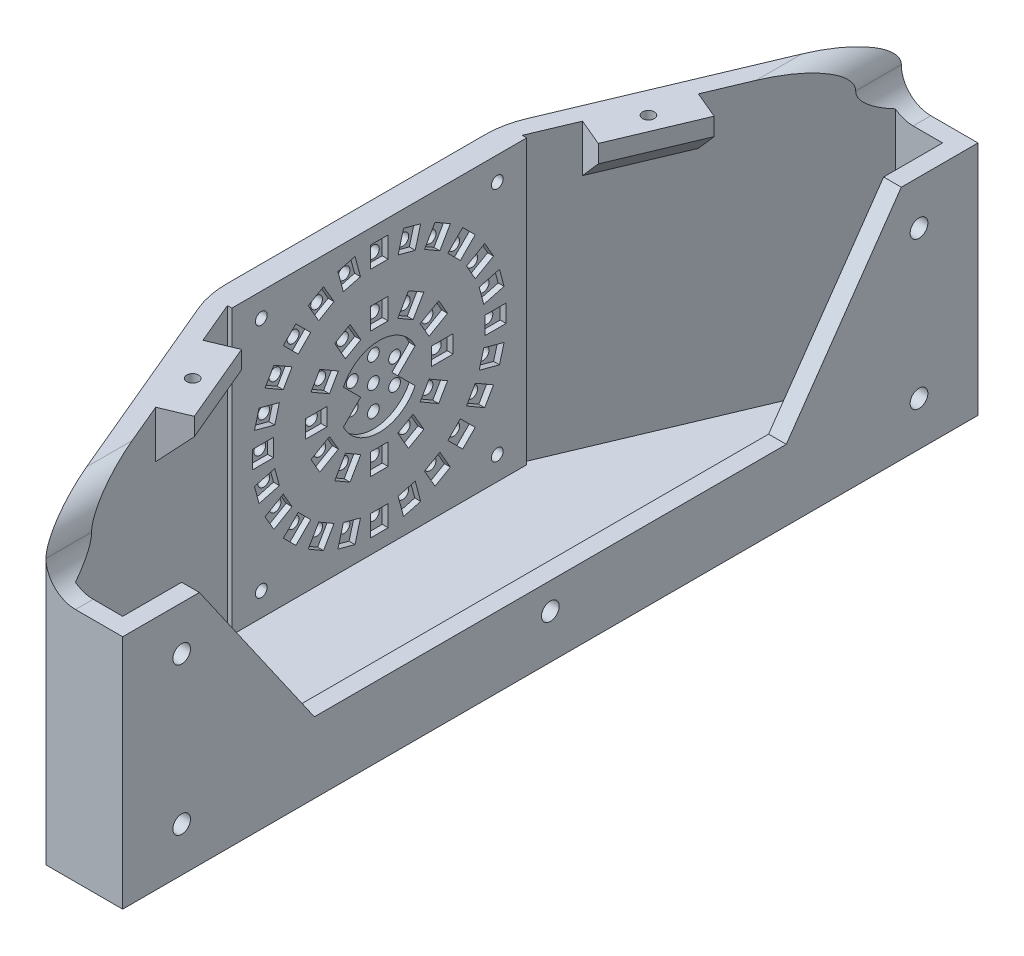
from build123d import *

# Parameters (mm, degrees)
EXTRUDE_1_DEPTH      = 4
SKETCH_2_W           = 6
SKETCH_2_H           = 290
EXTRUDE_2_DEPTH      = 80
EXTRUDE_1_2_DEPTH    = 96
SKETCH_29_W          = 8
SKETCH_29_H          = 100
EXTRUDE_5_DEPTH      = 96
SKETCH_20_W          = 6
SKETCH_20_H          = 7.125217771
SKETCH_20_W_2        = 7.125217771
SKETCH_20_H_2        = 6
SKETCH_20_H_3        = 7.251760651
SKETCH_20_W_3        = 7.251760651
CUT_EXTRUDE_7_DEPTH  = 2
SKETCH_16_R          = 3
CUT_EXTRUDE_6_DEPTH  = 20
SKETCH_21_R          = 2
LED_DEPTH            = 10
SKETCH_22_W          = 26
SKETCH_22_H          = 290
CUT_EXTRUDE_9_DEPTH  = 20
FILLET_2_R           = 10
FILLET_3_R           = 30
SKETCH_23_W          = 30
SKETCH_23_H          = 6
EXTRUDE_3_DEPTH      = 10
SKETCH_24_W          = 30
SKETCH_24_H          = 6
EXTRUDE_4_DEPTH      = 10
CHAMFER_1_SIZE       = 10
CUT_EXTRUDE_10_DEPTH = 10
CHAMFER_2_SIZE       = 2
SKETCH_30_R          = 2
CUT_EXTRUDE_11_DEPTH = 7
SKETCH_32_R          = 2
CUT_EXTRUDE_13_DEPTH = 7
CHAMFER_3_SIZE       = 2
CHAMFER_4_SIZE       = 2


# Some blends are built 0.0001 mm under size
with BuildPart() as part:
    # Эскиз1 → Extrude 1 (new body)
    with BuildSketch(Plane(origin=(0, 0, 0), x_dir=(1, 0, 0), z_dir=(0, 1, 0))):
        Polygon((-50, -50), (-50, 50), (-10, 145), (10, 145), (10, -145), (-10, -145), align=None)
    extrude(amount=EXTRUDE_1_DEPTH)

    # Эскиз2 → Бобышка-Вытянуть2 (add)
    with BuildSketch(Plane(origin=(0, 0, 0), x_dir=(1, 0, 0), z_dir=(0, 1, 0))):
        with Locations((13, 0)):
            Rectangle(SKETCH_2_W, SKETCH_2_H)
    extrude(amount=EXTRUDE_2_DEPTH)

    # Эскиз17 → Extrude 1 2 (add)
    with BuildSketch(Plane(origin=(0, 4, 0), x_dir=(1, 0, 0), z_dir=(0, 1, 0))):
        Polygon((-10, 145), (-50, 50), (-50, -50), (-10, -145), (16, -145), (16, 145), align=None)
        Polygon((-6.016149012, 139), (-44, 48.788353904), (-44, -48.788353904), (-6.016149012, -139), (10, -139), (10, 139), align=None, mode=Mode.SUBTRACT)
    extrude(amount=EXTRUDE_1_2_DEPTH)

    # Эскиз29 → Бобышка-Вытянуть5 (add)
    with BuildSketch(Plane(origin=(0, 100, 0), x_dir=(1, 0, 0), z_dir=(0, 1, 0))):
        with Locations((-46, 0)):
            Rectangle(SKETCH_29_W, SKETCH_29_H)
    extrude(amount=-EXTRUDE_5_DEPTH)

    # Эскиз20 → Вырез-Вытянуть7 (cut)
    with BuildSketch(Plane(origin=(-42, 0, 0), x_dir=(0, 0, -1), z_dir=(1, 0, 0))):
        Polygon((8.231441461, 94.311267666), (6.387299401, 87.428835803), (12.182854359, 85.875921532), (14.026996418, 92.758353395), align=None)
        with BuildLine():
            Line((6.3, 52), (12.161242978, 57.861242978))
            ThreePointArc((12.161242978, 57.861242978), (0, 65.5), (-12.161242978, 57.861242978))
            Line((-12.161242978, 57.861242978), (-6.3, 52))
            Line((-6.3, 52), (-12.161242978, 46.138757022))
            ThreePointArc((-12.161242978, 46.138757022), (0, 38.5), (12.161242978, 46.138757022))
            Line((12.161242978, 46.138757022), (6.3, 52))
        make_face()
        with Locations((0, 91.437391115)):
            Rectangle(SKETCH_20_W, SKETCH_20_H)
        Polygon((18.901923789, 90.739092363), (15.339314903, 84.568472766), (20.535467326, 81.568472766), (24.098076211, 87.739092363), align=None)
        Polygon((28.284271247, 84.526911935), (23.245981444, 79.488622131), (27.488622131, 75.245981444), (32.526911935, 80.284271247), align=None)
        Polygon((35.739092363, 76.098076211), (29.568472766, 72.535467326), (32.568472766, 67.339314903), (38.739092363, 70.901923789), align=None)
        Polygon((40.758353395, 66.026996418), (33.875921532, 64.182854359), (35.428835803, 58.387299401), (42.311267666, 60.231441461), align=None)
        with Locations((39.437391115, 52)):
            Rectangle(SKETCH_20_W_2, SKETCH_20_H_2)
        Polygon((42.311267666, 43.768558539), (35.428835803, 45.612700599), (33.875921532, 39.817145641), (40.758353395, 37.973003582), align=None)
        Polygon((38.739092363, 33.098076211), (32.568472766, 36.660685097), (29.568472766, 31.464532674), (35.739092363, 27.901923789), align=None)
        Polygon((32.526911935, 23.715728753), (27.488622131, 28.754018556), (23.245981444, 24.511377869), (28.284271247, 19.473088065), align=None)
        Polygon((24.098076211, 16.260907637), (20.535467326, 22.431527234), (15.339314903, 19.431527234), (18.901923789, 13.260907637), align=None)
        Polygon((14.026996418, 11.241646605), (12.182854359, 18.124078468), (6.387299401, 16.571164197), (8.231441461, 9.688732334), align=None)
        with Locations((0, 12.562608886)):
            Rectangle(SKETCH_20_W, SKETCH_20_H)
        Polygon((-8.231441461, 9.688732334), (-6.387299401, 16.571164197), (-12.182854359, 18.124078468), (-14.026996418, 11.241646605), align=None)
        Polygon((-18.901923789, 13.260907637), (-15.339314903, 19.431527234), (-20.535467326, 22.431527234), (-24.098076211, 16.260907637), align=None)
        Polygon((-28.284271247, 19.473088065), (-23.245981444, 24.511377869), (-27.488622131, 28.754018556), (-32.526911935, 23.715728753), align=None)
        Polygon((-35.739092363, 27.901923789), (-29.568472766, 31.464532674), (-32.568472766, 36.660685097), (-38.739092363, 33.098076211), align=None)
        Polygon((-40.758353395, 37.973003582), (-33.875921532, 39.817145641), (-35.428835803, 45.612700599), (-42.311267666, 43.768558539), align=None)
        with Locations((-39.437391115, 52)):
            Rectangle(SKETCH_20_W_2, SKETCH_20_H_2)
        Polygon((-42.311267666, 60.231441461), (-35.428835803, 58.387299401), (-33.875921532, 64.182854359), (-40.758353395, 66.026996418), align=None)
        Polygon((-38.739092363, 70.901923789), (-32.568472766, 67.339314903), (-29.568472766, 72.535467326), (-35.739092363, 76.098076211), align=None)
        Polygon((-32.526911935, 80.284271247), (-27.488622131, 75.245981444), (-23.245981444, 79.488622131), (-28.284271247, 84.526911935), align=None)
        Polygon((-24.098076211, 87.739092363), (-20.535467326, 81.568472766), (-15.339314903, 84.568472766), (-18.901923789, 90.739092363), align=None)
        Polygon((-14.026996418, 92.758353395), (-12.182854359, 85.875921532), (-6.387299401, 87.428835803), (-8.231441461, 94.311267666), align=None)
        Polygon((6.276043463, 68.870426149), (9.901923789, 75.150635095), (15.098076211, 72.150635095), (11.472195886, 65.870426149), align=None)
        with Locations((0, 73.374119675)):
            Rectangle(SKETCH_20_W, SKETCH_20_H_3)
        Polygon((13.870426149, 63.472195886), (20.150635095, 67.098076211), (23.150635095, 61.901923789), (16.870426149, 58.276043463), align=None)
        with Locations((21.374119675, 52)):
            Rectangle(SKETCH_20_W_3, SKETCH_20_H_2)
        Polygon((16.870426149, 45.723956537), (23.150635095, 42.098076211), (20.150635095, 36.901923789), (13.870426149, 40.527804114), align=None)
        Polygon((11.472195886, 38.129573851), (15.098076211, 31.849364905), (9.901923789, 28.849364905), (6.276043463, 35.129573851), align=None)
        with Locations((0, 30.625880326)):
            Rectangle(SKETCH_20_W, SKETCH_20_H_3)
        Polygon((-6.276043463, 35.129573851), (-9.901923789, 28.849364905), (-15.098076211, 31.849364905), (-11.472195886, 38.129573851), align=None)
        Polygon((-13.870426149, 40.527804114), (-20.150635095, 36.901923789), (-23.150635095, 42.098076211), (-16.870426149, 45.723956537), align=None)
        with Locations((-21.374119675, 52)):
            Rectangle(SKETCH_20_W_3, SKETCH_20_H_2)
        Polygon((-16.870426149, 58.276043463), (-23.150635095, 61.901923789), (-20.150635095, 67.098076211), (-13.870426149, 63.472195886), align=None)
        Polygon((-11.472195886, 65.870426149), (-15.098076211, 72.150635095), (-9.901923789, 75.150635095), (-6.276043463, 68.870426149), align=None)
    extrude(amount=-CUT_EXTRUDE_7_DEPTH, mode=Mode.SUBTRACT)

    # Эскиз16 → Вырез-Вытянуть6 (cut)
    with BuildSketch(Plane(origin=(16, 0, 0), x_dir=(0, 0, -1), z_dir=(1, 0, 0))):
        with Locations((0, 65)):
            Circle(SKETCH_16_R)
        with Locations((0, 15)):
            Circle(SKETCH_16_R)
        with Locations((125, 65)):
            Circle(SKETCH_16_R)
        with Locations((-125, 65)):
            Circle(SKETCH_16_R)
        with Locations((-125, 15)):
            Circle(SKETCH_16_R)
        with Locations((125, 15)):
            Circle(SKETCH_16_R)
    extrude(amount=-CUT_EXTRUDE_6_DEPTH, mode=Mode.SUBTRACT)

    # Эскиз21 → Отверстия под LED (cut)
    with BuildSketch(Plane(origin=(-42, 0, 0), x_dir=(0, 0, -1), z_dir=(1, 0, 0))):
        with Locations((0, 90.5)):
            Circle(SKETCH_21_R)
        with Locations((9.964533236, 89.188144312)):
            Circle(SKETCH_21_R)
        with Locations((19.25, 85.341978046)):
            Circle(SKETCH_21_R)
        with Locations((27.223611076, 79.223611076)):
            Circle(SKETCH_21_R)
        with Locations((33.341978046, 71.25)):
            Circle(SKETCH_21_R)
        with Locations((37.188144312, 61.964533236)):
            Circle(SKETCH_21_R)
        with Locations((38.5, 52)):
            Circle(SKETCH_21_R)
        with Locations((37.188144312, 42.035466764)):
            Circle(SKETCH_21_R)
        with Locations((33.341978046, 32.75)):
            Circle(SKETCH_21_R)
        with Locations((27.223611076, 24.776388924)):
            Circle(SKETCH_21_R)
        with Locations((19.25, 18.658021954)):
            Circle(SKETCH_21_R)
        with Locations((9.964533236, 14.811855688)):
            Circle(SKETCH_21_R)
        with Locations((0, 13.5)):
            Circle(SKETCH_21_R)
        with Locations((-9.964533236, 14.811855688)):
            Circle(SKETCH_21_R)
        with Locations((-19.25, 18.658021954)):
            Circle(SKETCH_21_R)
        with Locations((-27.223611076, 24.776388924)):
            Circle(SKETCH_21_R)
        with Locations((-33.341978046, 32.75)):
            Circle(SKETCH_21_R)
        with Locations((-37.188144312, 42.035466764)):
            Circle(SKETCH_21_R)
        with Locations((-38.5, 52)):
            Circle(SKETCH_21_R)
        with Locations((-37.188144312, 61.964533236)):
            Circle(SKETCH_21_R)
        with Locations((-33.341978046, 71.25)):
            Circle(SKETCH_21_R)
        with Locations((-27.223611076, 79.223611076)):
            Circle(SKETCH_21_R)
        with Locations((-19.25, 85.341978046)):
            Circle(SKETCH_21_R)
        with Locations((-9.964533236, 89.188144312)):
            Circle(SKETCH_21_R)
        with Locations((0, 73)):
            Circle(SKETCH_21_R)
        with Locations((10.5, 70.186533479)):
            Circle(SKETCH_21_R)
        with Locations((18.186533479, 62.5)):
            Circle(SKETCH_21_R)
        with Locations((21, 52)):
            Circle(SKETCH_21_R)
        with Locations((18.186533479, 41.5)):
            Circle(SKETCH_21_R)
        with Locations((10.5, 33.813466521)):
            Circle(SKETCH_21_R)
        with Locations((0, 31)):
            Circle(SKETCH_21_R)
        with Locations((-10.5, 33.813466521)):
            Circle(SKETCH_21_R)
        with Locations((-18.186533479, 41.5)):
            Circle(SKETCH_21_R)
        with Locations((-21, 52)):
            Circle(SKETCH_21_R)
        with Locations((-18.186533479, 62.5)):
            Circle(SKETCH_21_R)
        with Locations((-10.5, 70.186533479)):
            Circle(SKETCH_21_R)
        with Locations((0, 60.3)):
            Circle(SKETCH_21_R)
        with Locations((7.188010851, 56.15)):
            Circle(SKETCH_21_R)
        with Locations((7.188010851, 47.85)):
            Circle(SKETCH_21_R)
        with Locations((0, 43.7)):
            Circle(SKETCH_21_R)
        with Locations((-7.188010851, 47.85)):
            Circle(SKETCH_21_R)
        with Locations((-7.188010851, 56.15)):
            Circle(SKETCH_21_R)
        with Locations((0, 52)):
            Circle(SKETCH_21_R)
    extrude(amount=-LED_DEPTH, mode=Mode.SUBTRACT)

    # Эскиз22 → Вырез-Вытянуть9 (cut)
    with BuildSketch(Plane(origin=(0, 100, 0), x_dir=(1, 0, 0), z_dir=(0, 1, 0))):
        with Locations((3, 0)):
            Rectangle(SKETCH_22_W, SKETCH_22_H)
    extrude(amount=-CUT_EXTRUDE_9_DEPTH, mode=Mode.SUBTRACT)

    # Скругление2
    # the kernel refuses this fillet: 10 mm, written as the material it adds along each edge
    with BuildSketch(Plane(origin=(-10, 80, -145), x_dir=(0, 1, 0), z_dir=(0, 0, 1))) as fillet_2_piece_1_section:
        with BuildLine():
            CenterArc((FILLET_2_R, -FILLET_2_R), FILLET_2_R, 90, 90)
            Line((0, -FILLET_2_R), (0, 0))
            Line((0, 0), (FILLET_2_R, 0))
        make_face()
    fillet_2_piece_1 = extrude(amount=40.461646096, mode=Mode.PRIVATE)
    fillet_2_piece_1 = split(fillet_2_piece_1, bisect_by=Plane(origin=(-8.171006358, 82.420075, -139), z_dir=(0, 0, -1)), keep=Keep.TOP, mode=Mode.PRIVATE)
    add(fillet_2_piece_1)
    with BuildSketch(Plane(origin=(-10, 80, -170), x_dir=(0, 1, 0), z_dir=(0, 0, 1))) as fillet_2_piece_2_section:
        with BuildLine():
            CenterArc((FILLET_2_R, -FILLET_2_R), FILLET_2_R, 90, 90)
            Line((0, -FILLET_2_R), (0, 0))
            Line((0, 0), (FILLET_2_R, 0))
        make_face()
    fillet_2_piece_2 = extrude(amount=65.461646096, mode=Mode.PRIVATE)
    fillet_2_piece_2 = split(fillet_2_piece_2, bisect_by=Plane(origin=(-7.715017751, 83.017793979, -134.965186746), z_dir=(-0.9216353751380651, 0, -0.38805700005813326)), keep=Keep.TOP, mode=Mode.PRIVATE)
    fillet_2_piece_2 = split(fillet_2_piece_2, bisect_by=Plane(origin=(-8.969192832, 83.017793979, -139), z_dir=(0, 0, 1)), keep=Keep.TOP, mode=Mode.PRIVATE)
    add(fillet_2_piece_2)
    with BuildSketch(Plane(origin=(-10, 80, 104.538353904), x_dir=(0, 1, 0), z_dir=(0, 0, 1))) as fillet_2_piece_3_section:
        with BuildLine():
            CenterArc((FILLET_2_R, -FILLET_2_R), FILLET_2_R, 90, 90)
            Line((0, -FILLET_2_R), (0, 0))
            Line((0, 0), (FILLET_2_R, 0))
        make_face()
    fillet_2_piece_3 = extrude(amount=40.461646096, mode=Mode.PRIVATE)
    fillet_2_piece_3 = split(fillet_2_piece_3, bisect_by=Plane(origin=(-3.828623245, 80.420001638, 139), z_dir=(0, 0, 1)), keep=Keep.TOP, mode=Mode.PRIVATE)
    add(fillet_2_piece_3)
    with BuildSketch(Plane(origin=(-10, 80, 104.538353904), x_dir=(0, 1, 0), z_dir=(0, 0, 1))) as fillet_2_piece_4_section:
        with BuildLine():
            CenterArc((FILLET_2_R, -FILLET_2_R), FILLET_2_R, 90, 90)
            Line((0, -FILLET_2_R), (0, 0))
            Line((0, 0), (FILLET_2_R, 0))
        make_face()
    fillet_2_piece_4 = extrude(amount=65.461646096, mode=Mode.PRIVATE)
    fillet_2_piece_4 = split(fillet_2_piece_4, bisect_by=Plane(origin=(-7.715017751, 83.017793979, 134.965186746), z_dir=(-0.9216353751380651, 0, 0.38805700005813315)), keep=Keep.TOP, mode=Mode.PRIVATE)
    fillet_2_piece_4 = split(fillet_2_piece_4, bisect_by=Plane(origin=(-8.969192832, 83.017793979, 139), z_dir=(0, 0, -1)), keep=Keep.TOP, mode=Mode.PRIVATE)
    add(fillet_2_piece_4)
    # the kernel refuses this fillet: 10 mm, written as the material it takes off along each edge
    with BuildSketch(Plane(origin=(-10, 100, -170), x_dir=(0, -1, 0), z_dir=(0, 0, 1)), Plane(origin=(-10, 100, 104.538353904), x_dir=(0, -1, 0), z_dir=(0, 0, 1))) as fillet_2_2_piece_1:
        with BuildLine():
            CenterArc((FILLET_2_R, -FILLET_2_R), FILLET_2_R, 90, 90)
            Line((0, -FILLET_2_R), (0, 0))
            Line((0, 0), (FILLET_2_R, 0))
        make_face()
    extrude(amount=65.461646096, mode=Mode.SUBTRACT)

    # Скругление3
    fillet_3_edges = [part.edges().sort_by_distance(p)[0] for p in [
        (-50, 50, 50),
        (-50, 50, -50),
    ]]
    fillet(fillet_3_edges, radius=FILLET_3_R)

    # Эскиз23 → Бобышка-Вытянуть3 (add)
    with BuildSketch(Plane(origin=(-54.823128926, 0, -23.083422706), x_dir=(0.38805700005813276, 0, -0.9216353751380653), z_dir=(0.9216353751380653, 0, 0.38805700005813276))):
        with Locations((59.783374754, 97)):
            Rectangle(SKETCH_23_W, SKETCH_23_H)
    extrude(amount=EXTRUDE_3_DEPTH)

    # Эскиз24 → Бобышка-Вытянуть4 (add)
    with BuildSketch(Plane(origin=(-54.823128926, 0, 23.083422706), x_dir=(-0.3880570000581327, 0, -0.9216353751380654), z_dir=(0.9216353751380654, 0, -0.3880570000581327))):
        with Locations((-59.783374754, 97)):
            Rectangle(SKETCH_24_W, SKETCH_24_H)
    extrude(amount=EXTRUDE_4_DEPTH)

    # Фаска1
    chamfer_1_edges = [part.edges().sort_by_distance(p)[0] for p in [
        (-31.623771865, 94, -78.181895724),
        (-31.623771865, 94, 78.181895724),
    ]]
    chamfer(chamfer_1_edges, length=CHAMFER_1_SIZE - 0.0001)  # a hair under: the kernel refuses the full size

    # Эскиз27 → Вырез-Вытянуть10 (cut)
    with BuildSketch(Plane(origin=(16, 0, 0), x_dir=(0, 0, -1), z_dir=(1, 0, 0))):
        Polygon((-80, 24), (80, 24), (119, 80), (-119, 80), align=None)
    extrude(amount=-CUT_EXTRUDE_10_DEPTH, mode=Mode.SUBTRACT)

    # Фаска2
    chamfer_2_edges = [part.edges().sort_by_distance(p)[0] for p in [
        (-50, 32.75, 35.341978046),
        (-50, 42.035466764, 39.188144312),
        (-50, 52, 40.5),
        (-50, 61.964533236, 39.188144312),
        (-50, 71.25, 35.341978046),
        (-50, 79.223611076, 29.223611076),
        (-50, 85.341978046, 21.25),
        (-50, 89.188144312, 11.964533236),
        (-50, 24.776388924, 29.223611076),
        (-50, 18.658021954, 21.25),
        (-50, 14.811855688, 11.964533236),
        (-50, 13.5, 2),
        (-50, 14.811855688, -7.964533236),
        (-50, 18.658021954, -17.25),
        (-50, 24.776388924, -25.223611076),
        (-50, 32.75, -31.341978046),
        (-50, 42.035466764, -35.188144312),
        (-50, 52, -36.5),
        (-50, 61.964533236, -35.188144312),
        (-50, 71.25, -31.341978046),
        (-50, 79.223611076, -25.223611076),
        (-50, 85.341978046, -17.25),
        (-50, 89.188144312, -7.964533236),
        (-50, 90.5, 2),
    ]]
    chamfer(chamfer_2_edges, length=CHAMFER_2_SIZE)

    # Эскиз30 → Вырез-Вытянуть11 (cut)
    with BuildSketch(Plane(origin=(-42, 0, 0), x_dir=(0, 0, -1), z_dir=(1, 0, 0))):
        with Locations((-40, 92)):
            Circle(SKETCH_30_R)
        with Locations((40, 92)):
            Circle(SKETCH_30_R)
        with Locations((-40, 12)):
            Circle(SKETCH_30_R)
        with Locations((40, 12)):
            Circle(SKETCH_30_R)
    extrude(amount=-CUT_EXTRUDE_11_DEPTH, mode=Mode.SUBTRACT)

    # Эскиз32 → Вырез-Вытянуть13 (cut)
    with BuildSketch(Plane(origin=(0, 100, 0), x_dir=(1, 0, 0), z_dir=(0, 1, 0))):
        with Locations(Location((-28, 77.261926747, 0), (0, 0, 270))):
            Circle(SKETCH_32_R)
        with Locations(Location((-28, -77.261926747, 0), (0, 0, 90))):
            Circle(SKETCH_32_R)
    extrude(amount=-CUT_EXTRUDE_13_DEPTH, mode=Mode.SUBTRACT)

    # Фаска3
    chamfer_3_edges = [part.edges().sort_by_distance(p)[0] for p in [
        (-50, 60.3, 2),
        (-50, 56.15, 9.188010851),
        (-50, 47.85, 9.188010851),
        (-50, 43.7, 2),
        (-50, 47.85, -5.188010851),
        (-50, 56.15, -5.188010851),
        (-50, 52, 2),
    ]]
    chamfer(chamfer_3_edges, length=CHAMFER_3_SIZE)

    # Фаска4
    chamfer_4_edges = [part.edges().sort_by_distance(p)[0] for p in [
        (-50, 70.186533479, -8.5),
        (-50, 62.5, -16.186533479),
        (-50, 52, -19),
        (-50, 41.5, -16.186533479),
        (-50, 33.813466521, -8.5),
        (-50, 31, 2),
        (-50, 33.813466521, 12.5),
        (-50, 73, 2),
        (-50, 70.186533479, 12.5),
        (-50, 62.5, 20.186533479),
        (-50, 52, 23),
        (-50, 41.5, 20.186533479),
    ]]
    chamfer(chamfer_4_edges, length=CHAMFER_4_SIZE)


solid = part.part
